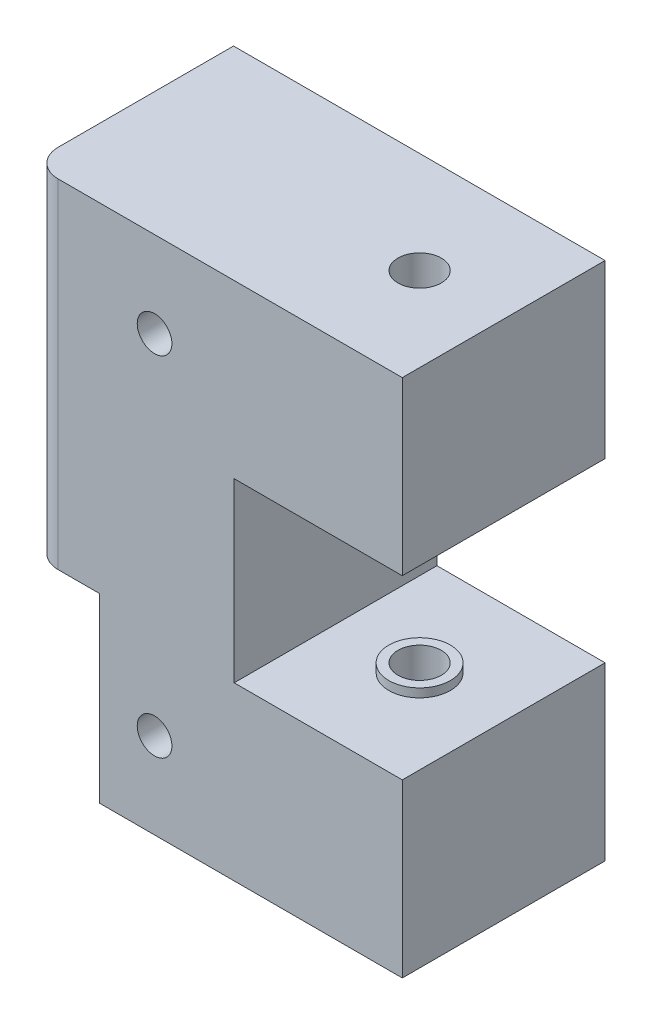
from build123d import *

# Parameters (mm, degrees)
MAINBLOCK_R                     = 2
MAINBLOCKBOSS_EXTRUDE1_DEPTH    = 23.4
TOPHOLECUT_SKETCH2_R            = 2.5
TOPHOLECUT_EXTRUDE1_DEPTH       = 45
TOPSPACERSKETCH4_R              = 3.55
TOPSPACERSKETCH4_R_2            = 2.5
TOPSPACERBOSS_EXTRUDE2_DEPTH    = 1
LOWERSPACERBOSS_EXTRUDE3_START  = 1
LOWERSPACERSKETCH5_R            = 3.55
LOWERSPACERSKETCH5_R_2          = 2.5
LOWERSPACERBOSS_EXTRUDE3_DEPTH  = 1
MOUNTHOLEBORECUT_EXTRUDE1_DEPTH = 2
PUSHPINHOLESKETCH1_R            = 2
PUSHPINHOLECUT_EXTRUDE1_DEPTH   = 78.368117626
MIDRAILINSETSKETCH1_W           = 7.9375
MIDRAILINSETSKETCH1_H           = 20.94983
MIDRAILINSETCUT_EXTRUDE2_DEPTH  = 78.368117626
VERTICALSUPPORTFILLET1_R        = 3.175


with BuildPart() as part:
    # MainBlock → MainBlockBoss-Extrude1 (new body)
    with BuildSketch(Plane.XY):
        Polygon((0, 0), (42.875, 0), (42.875, 19.8), (23.475, 19.8), (23.475, 40.2), (42.875, 40.2), (42.875, 60), (0, 60), align=None)
        with Locations((14.2875, 50.1)):
            Circle(MAINBLOCK_R, mode=Mode.SUBTRACT)
        with Locations((14.2875, 9.9)):
            Circle(MAINBLOCK_R, mode=Mode.SUBTRACT)
    extrude(amount=MAINBLOCKBOSS_EXTRUDE1_DEPTH)

    # TopHoleCut-Sketch2 → TopHoleCut-Extrude1 (cut)
    with BuildSketch(Plane(origin=(0, 60, 0), x_dir=(1, 0, 0), z_dir=(0, 1, 0))):
        with Locations((33.175, -11.7)):
            Circle(TOPHOLECUT_SKETCH2_R)
    extrude(amount=-TOPHOLECUT_EXTRUDE1_DEPTH, mode=Mode.SUBTRACT)

    # TopSpacerSketch4 → TopSpacerBoss-Extrude2 (add)
    with BuildSketch(Plane.XZ.offset(-40.2)):
        with Locations((33.175, 11.7)):
            Circle(TOPSPACERSKETCH4_R)
        with Locations((33.175, 11.7)):
            Circle(TOPSPACERSKETCH4_R_2, mode=Mode.SUBTRACT)
    extrude(amount=TOPSPACERBOSS_EXTRUDE2_DEPTH)

    # LowerSpacerSketch5 → LowerSpacerBoss-Extrude3 (add)
    with BuildSketch(Plane(origin=(0, 19.8, 0), x_dir=(1, 0, 0), z_dir=(0, 1, 0)).offset(LOWERSPACERBOSS_EXTRUDE3_START)):
        with Locations((33.175, -11.7)):
            Circle(LOWERSPACERSKETCH5_R)
        with Locations((33.175, -11.7)):
            Circle(LOWERSPACERSKETCH5_R_2, mode=Mode.SUBTRACT)
    extrude(amount=-LOWERSPACERBOSS_EXTRUDE3_DEPTH)

    # MountHoleBoreSketch1 → MountHoleBoreCut-Extrude1 (cut)
    with BuildSketch(Plane(origin=(0, 0, 0), x_dir=(-1, 0, 0), z_dir=(0, 0, -1))):
        Polygon((-10.4125, 50.1), (-12.35, 53.45584844), (-16.225, 53.45584844), (-18.1625, 50.1), (-16.225, 46.74415156), (-12.35, 46.74415156), align=None)
        Polygon((-10.4125, 9.9), (-12.35, 13.25584844), (-16.225, 13.25584844), (-18.1625, 9.9), (-16.225, 6.54415156), (-12.35, 6.54415156), align=None)
    extrude(amount=-MOUNTHOLEBORECUT_EXTRUDE1_DEPTH, mode=Mode.SUBTRACT)

    # PushPinHoleSketch1 → PushPinHoleCut-Extrude1 (cut, through all)
    with BuildSketch(Plane.XZ):
        with Locations((33.175, 11.7)):
            Circle(PUSHPINHOLESKETCH1_R)
    extrude(amount=-PUSHPINHOLECUT_EXTRUDE1_DEPTH, mode=Mode.SUBTRACT)

    # MidRailInsetSketch1 → MidRailInsetCut-Extrude2 (cut, through all)
    with BuildSketch(Plane(origin=(0, 0, 0), x_dir=(-1, 0, 0), z_dir=(0, 0, -1))):
        with Locations((-3.96875, 10.474915)):
            Rectangle(MIDRAILINSETSKETCH1_W, MIDRAILINSETSKETCH1_H)
    extrude(amount=-MIDRAILINSETCUT_EXTRUDE2_DEPTH, mode=Mode.SUBTRACT)

    # VerticalSupportFillet1
    verticalsupportfillet1_edges = [part.edges().sort_by_distance(p)[0] for p in [
        (0, 40.474915, 23.4),
    ]]
    fillet(verticalsupportfillet1_edges, radius=VERTICALSUPPORTFILLET1_R)


solid = part.part
